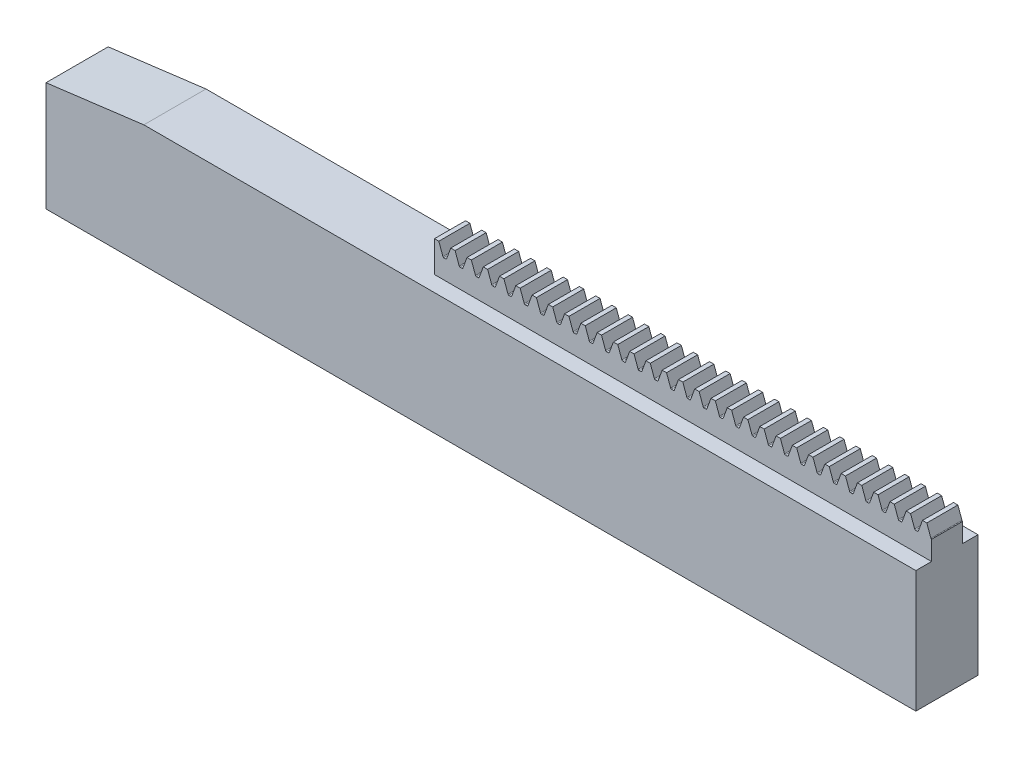
from build123d import *

# Parameters (mm, degrees)
SKETCH2_W           = 3.175
SKETCH2_H           = 3.175
BOSS_EXTRUDE1_DEPTH = 50.8
CUT_EXTRUDE1_DEPTH  = 51.92387241
FILLET1_R           = 0.099598028
LPATTERN1_START     = -1.5875
LPATTERN1_DEPTH     = 3.175
SKETCH5_W           = 6.35
SKETCH5_H           = 12.446
BOSS_EXTRUDE2_DEPTH = 88.9
CHAMFER1_SIZE       = 10
CHAMFER1_SIZE2      = 1.27


# Read off the part's stored shape, not the designer's step: LPattern1
with BuildPart() as part:
    # Sketch2 → Boss-Extrude1 (new body)
    with BuildSketch(Plane(origin=(0, 0, 0), x_dir=(0, 0, -1), z_dir=(1, 0, 0))):
        with Locations((0, 1.5875)):
            Rectangle(SKETCH2_W, SKETCH2_H)
    extrude(amount=BOSS_EXTRUDE1_DEPTH)

    # Sketch3 → Cut-Extrude1 (cut, symmetric)
    with BuildSketch(Plane.XY):
        Polygon((0.446013169, 3.175), (0.888224871, 1.960033333), (1.220218298, 1.960033333), (1.66243, 3.175), align=None)
    extrude(amount=CUT_EXTRUDE1_DEPTH, both=True, mode=Mode.SUBTRACT)

    # Fillet1
    fillet1_edges = [part.edges().sort_by_distance(p)[0] for p in [
        (1.220218298, 1.960033333, 0),
        (0.888224871, 1.960033333, 0),
    ]]
    fillet(fillet1_edges, radius=FILLET1_R)

    # LPattern1 outline → LPattern1 (cut)
    with BuildSketch(Plane.XY.offset(LPATTERN1_START)):
        with BuildLine():
            ThreePointArc((2.526802629, 2.02556683), (2.563267079, 1.978045433), (2.620394161, 1.960033333))
            Line((2.620394161, 1.960033333), (2.812909008, 1.960033333))
            ThreePointArc((2.812909008, 1.960033333), (2.87003609, 1.978045433), (2.90650054, 2.02556683))
            Line((2.90650054, 2.02556683), (3.32486, 3.175))
            Line((3.32486, 3.175), (2.108443169, 3.175))
            Line((2.108443169, 3.175), (2.526802629, 2.02556683))
        make_face()
        with BuildLine():
            Line((50.8, 3.175), (50.318913169, 3.175))
            Line((50.318913169, 3.175), (50.737272629, 2.02556683))
            ThreePointArc((50.737272629, 2.02556683), (50.76164478, 1.988018203), (50.8, 1.964936215))
            Line((50.8, 1.964936215), (50.8, 3.175))
        make_face()
        with BuildLine():
            Line((49.8729, 3.175), (48.656483169, 3.175))
            Line((48.656483169, 3.175), (49.074842629, 2.02556683))
            ThreePointArc((49.074842629, 2.02556683), (49.111307079, 1.978045433), (49.168434161, 1.960033333))
            Line((49.168434161, 1.960033333), (49.360949008, 1.960033333))
            ThreePointArc((49.360949008, 1.960033333), (49.41807609, 1.978045433), (49.45454054, 2.02556683))
            Line((49.45454054, 2.02556683), (49.8729, 3.175))
        make_face()
        with BuildLine():
            Line((48.21047, 3.175), (46.994053169, 3.175))
            Line((46.994053169, 3.175), (47.412412629, 2.02556683))
            ThreePointArc((47.412412629, 2.02556683), (47.448877079, 1.978045433), (47.506004161, 1.960033333))
            Line((47.506004161, 1.960033333), (47.698519008, 1.960033333))
            ThreePointArc((47.698519008, 1.960033333), (47.75564609, 1.978045433), (47.79211054, 2.02556683))
            Line((47.79211054, 2.02556683), (48.21047, 3.175))
        make_face()
        with BuildLine():
            Line((46.54804, 3.175), (45.331623169, 3.175))
            Line((45.331623169, 3.175), (45.749982629, 2.02556683))
            ThreePointArc((45.749982629, 2.02556683), (45.786447079, 1.978045433), (45.843574161, 1.960033333))
            Line((45.843574161, 1.960033333), (46.036089008, 1.960033333))
            ThreePointArc((46.036089008, 1.960033333), (46.09321609, 1.978045433), (46.12968054, 2.02556683))
            Line((46.12968054, 2.02556683), (46.54804, 3.175))
        make_face()
        with BuildLine():
            Line((44.88561, 3.175), (43.669193169, 3.175))
            Line((43.669193169, 3.175), (44.087552629, 2.02556683))
            ThreePointArc((44.087552629, 2.02556683), (44.124017079, 1.978045433), (44.181144161, 1.960033333))
            Line((44.181144161, 1.960033333), (44.373659008, 1.960033333))
            ThreePointArc((44.373659008, 1.960033333), (44.43078609, 1.978045433), (44.46725054, 2.02556683))
            Line((44.46725054, 2.02556683), (44.88561, 3.175))
        make_face()
        with BuildLine():
            Line((43.22318, 3.175), (42.006763169, 3.175))
            Line((42.006763169, 3.175), (42.425122629, 2.02556683))
            ThreePointArc((42.425122629, 2.02556683), (42.461587079, 1.978045433), (42.518714161, 1.960033333))
            Line((42.518714161, 1.960033333), (42.711229008, 1.960033333))
            ThreePointArc((42.711229008, 1.960033333), (42.76835609, 1.978045433), (42.80482054, 2.02556683))
            Line((42.80482054, 2.02556683), (43.22318, 3.175))
        make_face()
        with BuildLine():
            Line((41.56075, 3.175), (40.344333169, 3.175))
            Line((40.344333169, 3.175), (40.762692629, 2.02556683))
            ThreePointArc((40.762692629, 2.02556683), (40.799157079, 1.978045433), (40.856284161, 1.960033333))
            Line((40.856284161, 1.960033333), (41.048799008, 1.960033333))
            ThreePointArc((41.048799008, 1.960033333), (41.10592609, 1.978045433), (41.14239054, 2.02556683))
            Line((41.14239054, 2.02556683), (41.56075, 3.175))
        make_face()
        with BuildLine():
            Line((39.89832, 3.175), (38.681903169, 3.175))
            Line((38.681903169, 3.175), (39.100262629, 2.02556683))
            ThreePointArc((39.100262629, 2.02556683), (39.136727079, 1.978045433), (39.193854161, 1.960033333))
            Line((39.193854161, 1.960033333), (39.386369008, 1.960033333))
            ThreePointArc((39.386369008, 1.960033333), (39.44349609, 1.978045433), (39.47996054, 2.02556683))
            Line((39.47996054, 2.02556683), (39.89832, 3.175))
        make_face()
        with BuildLine():
            Line((38.23589, 3.175), (37.019473169, 3.175))
            Line((37.019473169, 3.175), (37.437832629, 2.02556683))
            ThreePointArc((37.437832629, 2.02556683), (37.474297079, 1.978045433), (37.531424161, 1.960033333))
            Line((37.531424161, 1.960033333), (37.723939008, 1.960033333))
            ThreePointArc((37.723939008, 1.960033333), (37.78106609, 1.978045433), (37.81753054, 2.02556683))
            Line((37.81753054, 2.02556683), (38.23589, 3.175))
        make_face()
        with BuildLine():
            Line((36.57346, 3.175), (35.357043169, 3.175))
            Line((35.357043169, 3.175), (35.775402629, 2.02556683))
            ThreePointArc((35.775402629, 2.02556683), (35.811867079, 1.978045433), (35.868994161, 1.960033333))
            Line((35.868994161, 1.960033333), (36.061509008, 1.960033333))
            ThreePointArc((36.061509008, 1.960033333), (36.11863609, 1.978045433), (36.15510054, 2.02556683))
            Line((36.15510054, 2.02556683), (36.57346, 3.175))
        make_face()
        with BuildLine():
            Line((34.91103, 3.175), (33.694613169, 3.175))
            Line((33.694613169, 3.175), (34.112972629, 2.02556683))
            ThreePointArc((34.112972629, 2.02556683), (34.149437079, 1.978045433), (34.206564161, 1.960033333))
            Line((34.206564161, 1.960033333), (34.399079008, 1.960033333))
            ThreePointArc((34.399079008, 1.960033333), (34.45620609, 1.978045433), (34.49267054, 2.02556683))
            Line((34.49267054, 2.02556683), (34.91103, 3.175))
        make_face()
        with BuildLine():
            Line((33.2486, 3.175), (32.032183169, 3.175))
            Line((32.032183169, 3.175), (32.450542629, 2.02556683))
            ThreePointArc((32.450542629, 2.02556683), (32.487007079, 1.978045433), (32.544134161, 1.960033333))
            Line((32.544134161, 1.960033333), (32.736649008, 1.960033333))
            ThreePointArc((32.736649008, 1.960033333), (32.79377609, 1.978045433), (32.83024054, 2.02556683))
            Line((32.83024054, 2.02556683), (33.2486, 3.175))
        make_face()
        with BuildLine():
            Line((31.58617, 3.175), (30.369753169, 3.175))
            Line((30.369753169, 3.175), (30.788112629, 2.02556683))
            ThreePointArc((30.788112629, 2.02556683), (30.824577079, 1.978045433), (30.881704161, 1.960033333))
            Line((30.881704161, 1.960033333), (31.074219008, 1.960033333))
            ThreePointArc((31.074219008, 1.960033333), (31.13134609, 1.978045433), (31.16781054, 2.02556683))
            Line((31.16781054, 2.02556683), (31.58617, 3.175))
        make_face()
        with BuildLine():
            Line((29.92374, 3.175), (28.707323169, 3.175))
            Line((28.707323169, 3.175), (29.125682629, 2.02556683))
            ThreePointArc((29.125682629, 2.02556683), (29.162147079, 1.978045433), (29.219274161, 1.960033333))
            Line((29.219274161, 1.960033333), (29.411789008, 1.960033333))
            ThreePointArc((29.411789008, 1.960033333), (29.46891609, 1.978045433), (29.50538054, 2.02556683))
            Line((29.50538054, 2.02556683), (29.92374, 3.175))
        make_face()
        with BuildLine():
            Line((28.26131, 3.175), (27.044893169, 3.175))
            Line((27.044893169, 3.175), (27.463252629, 2.02556683))
            ThreePointArc((27.463252629, 2.02556683), (27.499717079, 1.978045433), (27.556844161, 1.960033333))
            Line((27.556844161, 1.960033333), (27.749359008, 1.960033333))
            ThreePointArc((27.749359008, 1.960033333), (27.80648609, 1.978045433), (27.84295054, 2.02556683))
            Line((27.84295054, 2.02556683), (28.26131, 3.175))
        make_face()
        with BuildLine():
            Line((26.59888, 3.175), (25.382463169, 3.175))
            Line((25.382463169, 3.175), (25.800822629, 2.02556683))
            ThreePointArc((25.800822629, 2.02556683), (25.837287079, 1.978045433), (25.894414161, 1.960033333))
            Line((25.894414161, 1.960033333), (26.086929008, 1.960033333))
            ThreePointArc((26.086929008, 1.960033333), (26.14405609, 1.978045433), (26.18052054, 2.02556683))
            Line((26.18052054, 2.02556683), (26.59888, 3.175))
        make_face()
        with BuildLine():
            Line((24.93645, 3.175), (23.720033169, 3.175))
            Line((23.720033169, 3.175), (24.138392629, 2.02556683))
            ThreePointArc((24.138392629, 2.02556683), (24.174857079, 1.978045433), (24.231984161, 1.960033333))
            Line((24.231984161, 1.960033333), (24.424499008, 1.960033333))
            ThreePointArc((24.424499008, 1.960033333), (24.48162609, 1.978045433), (24.51809054, 2.02556683))
            Line((24.51809054, 2.02556683), (24.93645, 3.175))
        make_face()
        with BuildLine():
            Line((23.27402, 3.175), (22.057603169, 3.175))
            Line((22.057603169, 3.175), (22.475962629, 2.02556683))
            ThreePointArc((22.475962629, 2.02556683), (22.512427079, 1.978045433), (22.569554161, 1.960033333))
            Line((22.569554161, 1.960033333), (22.762069008, 1.960033333))
            ThreePointArc((22.762069008, 1.960033333), (22.81919609, 1.978045433), (22.85566054, 2.02556683))
            Line((22.85566054, 2.02556683), (23.27402, 3.175))
        make_face()
        with BuildLine():
            Line((21.61159, 3.175), (20.395173169, 3.175))
            Line((20.395173169, 3.175), (20.813532629, 2.02556683))
            ThreePointArc((20.813532629, 2.02556683), (20.849997079, 1.978045433), (20.907124161, 1.960033333))
            Line((20.907124161, 1.960033333), (21.099639008, 1.960033333))
            ThreePointArc((21.099639008, 1.960033333), (21.15676609, 1.978045433), (21.19323054, 2.02556683))
            Line((21.19323054, 2.02556683), (21.61159, 3.175))
        make_face()
        with BuildLine():
            Line((19.94916, 3.175), (18.732743169, 3.175))
            Line((18.732743169, 3.175), (19.151102629, 2.02556683))
            ThreePointArc((19.151102629, 2.02556683), (19.187567079, 1.978045433), (19.244694161, 1.960033333))
            Line((19.244694161, 1.960033333), (19.437209008, 1.960033333))
            ThreePointArc((19.437209008, 1.960033333), (19.49433609, 1.978045433), (19.53080054, 2.02556683))
            Line((19.53080054, 2.02556683), (19.94916, 3.175))
        make_face()
        with BuildLine():
            Line((18.28673, 3.175), (17.070313169, 3.175))
            Line((17.070313169, 3.175), (17.488672629, 2.02556683))
            ThreePointArc((17.488672629, 2.02556683), (17.525137079, 1.978045433), (17.582264161, 1.960033333))
            Line((17.582264161, 1.960033333), (17.774779008, 1.960033333))
            ThreePointArc((17.774779008, 1.960033333), (17.83190609, 1.978045433), (17.86837054, 2.02556683))
            Line((17.86837054, 2.02556683), (18.28673, 3.175))
        make_face()
        with BuildLine():
            Line((16.6243, 3.175), (15.407883169, 3.175))
            Line((15.407883169, 3.175), (15.826242629, 2.02556683))
            ThreePointArc((15.826242629, 2.02556683), (15.862707079, 1.978045433), (15.919834161, 1.960033333))
            Line((15.919834161, 1.960033333), (16.112349008, 1.960033333))
            ThreePointArc((16.112349008, 1.960033333), (16.16947609, 1.978045433), (16.20594054, 2.02556683))
            Line((16.20594054, 2.02556683), (16.6243, 3.175))
        make_face()
        with BuildLine():
            Line((14.96187, 3.175), (13.745453169, 3.175))
            Line((13.745453169, 3.175), (14.163812629, 2.02556683))
            ThreePointArc((14.163812629, 2.02556683), (14.200277079, 1.978045433), (14.257404161, 1.960033333))
            Line((14.257404161, 1.960033333), (14.449919008, 1.960033333))
            ThreePointArc((14.449919008, 1.960033333), (14.50704609, 1.978045433), (14.54351054, 2.02556683))
            Line((14.54351054, 2.02556683), (14.96187, 3.175))
        make_face()
        with BuildLine():
            Line((13.29944, 3.175), (12.083023169, 3.175))
            Line((12.083023169, 3.175), (12.501382629, 2.02556683))
            ThreePointArc((12.501382629, 2.02556683), (12.537847079, 1.978045433), (12.594974161, 1.960033333))
            Line((12.594974161, 1.960033333), (12.787489008, 1.960033333))
            ThreePointArc((12.787489008, 1.960033333), (12.84461609, 1.978045433), (12.88108054, 2.02556683))
            Line((12.88108054, 2.02556683), (13.29944, 3.175))
        make_face()
        with BuildLine():
            Line((11.63701, 3.175), (10.420593169, 3.175))
            Line((10.420593169, 3.175), (10.838952629, 2.02556683))
            ThreePointArc((10.838952629, 2.02556683), (10.875417079, 1.978045433), (10.932544161, 1.960033333))
            Line((10.932544161, 1.960033333), (11.125059008, 1.960033333))
            ThreePointArc((11.125059008, 1.960033333), (11.18218609, 1.978045433), (11.21865054, 2.02556683))
            Line((11.21865054, 2.02556683), (11.63701, 3.175))
        make_face()
        with BuildLine():
            Line((9.97458, 3.175), (8.758163169, 3.175))
            Line((8.758163169, 3.175), (9.176522629, 2.02556683))
            ThreePointArc((9.176522629, 2.02556683), (9.212987079, 1.978045433), (9.270114161, 1.960033333))
            Line((9.270114161, 1.960033333), (9.462629008, 1.960033333))
            ThreePointArc((9.462629008, 1.960033333), (9.51975609, 1.978045433), (9.55622054, 2.02556683))
            Line((9.55622054, 2.02556683), (9.97458, 3.175))
        make_face()
        with BuildLine():
            Line((8.31215, 3.175), (7.095733169, 3.175))
            Line((7.095733169, 3.175), (7.514092629, 2.02556683))
            ThreePointArc((7.514092629, 2.02556683), (7.550557079, 1.978045433), (7.607684161, 1.960033333))
            Line((7.607684161, 1.960033333), (7.800199008, 1.960033333))
            ThreePointArc((7.800199008, 1.960033333), (7.85732609, 1.978045433), (7.89379054, 2.02556683))
            Line((7.89379054, 2.02556683), (8.31215, 3.175))
        make_face()
        with BuildLine():
            Line((6.64972, 3.175), (5.433303169, 3.175))
            Line((5.433303169, 3.175), (5.851662629, 2.02556683))
            ThreePointArc((5.851662629, 2.02556683), (5.888127079, 1.978045433), (5.945254161, 1.960033333))
            Line((5.945254161, 1.960033333), (6.137769008, 1.960033333))
            ThreePointArc((6.137769008, 1.960033333), (6.19489609, 1.978045433), (6.23136054, 2.02556683))
            Line((6.23136054, 2.02556683), (6.64972, 3.175))
        make_face()
        with BuildLine():
            Line((4.98729, 3.175), (3.770873169, 3.175))
            Line((3.770873169, 3.175), (4.189232629, 2.02556683))
            ThreePointArc((4.189232629, 2.02556683), (4.225697079, 1.978045433), (4.282824161, 1.960033333))
            Line((4.282824161, 1.960033333), (4.475339008, 1.960033333))
            ThreePointArc((4.475339008, 1.960033333), (4.53246609, 1.978045433), (4.56893054, 2.02556683))
            Line((4.56893054, 2.02556683), (4.98729, 3.175))
        make_face()
    extrude(amount=LPATTERN1_DEPTH, mode=Mode.SUBTRACT)

    # Sketch5 → Boss-Extrude2 (add)
    with BuildSketch(Plane(origin=(50.8, 0, 0), x_dir=(0, 0, -1), z_dir=(1, 0, 0))):
        with Locations((-0.0127, -6.223)):
            Rectangle(SKETCH5_W, SKETCH5_H)
    extrude(amount=-BOSS_EXTRUDE2_DEPTH)

    # Chamfer1
    chamfer1_edges = [part.edges().sort_by_distance(p)[0] for p in [
        (-38.1, 0, 0.0127),
    ]]
    chamfer1_side = [part.faces().sort_by_distance(p)[0] for p in [
        (-1.27, 0, 0.01778),
    ]]
    chamfer(chamfer1_edges, length=CHAMFER1_SIZE, length2=CHAMFER1_SIZE2, reference=chamfer1_side[0])


solid = part.part
